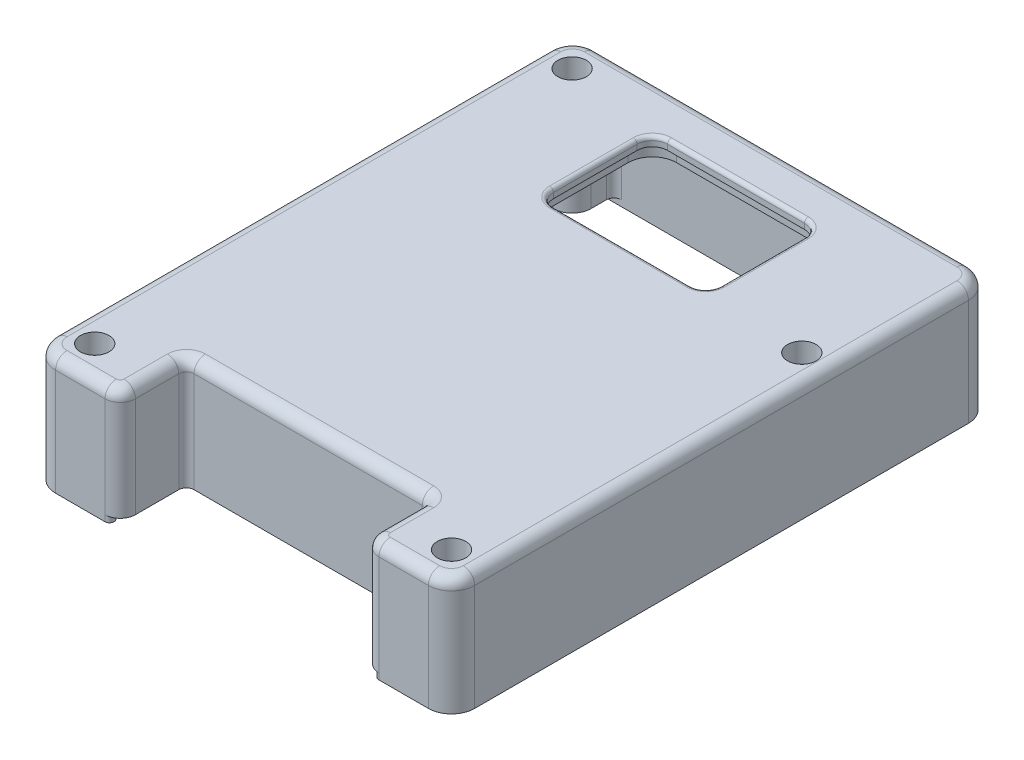
from build123d import *

# Parameters (mm, degrees)
ESQUISSE1_R             = 1.1
BOSS_EXTRU_1_DEPTH      = 13.5
BOSS_EXTRU_2_DEPTH      = 1.2
CONG_1_R                = 1.5
BOSS_EXTRU_3_START      = 0.8
BOSS_EXTRU_3_DEPTH      = 0.8
ESQUISSE4_W             = 37.676641801
ESQUISSE4_H             = 10.486455041
ENL_V_MAT_EXTRU_1_DEPTH = 0.8
CONG_2_R                = 0.6
ESQUISSE5_R             = 1.25
ENL_V_MAT_EXTRU_2_DEPTH = 48.156574303
ESQUISSE6_R             = 1.875
ENL_V_MAT_EXTRU_3_DEPTH = 3.3
CONG_3_R                = 0.6
CONG_4_R                = 0.7
ENL_V_MAT_EXTRU_4_DEPTH = 10
BOSS_EXTRU_4_DEPTH      = 2
CONG_5_R                = 0.5


with BuildPart() as part:
    # Esquisse1 → Boss.-Extru.1 (new body)
    with BuildSketch(Plane(origin=(0, 0, 0), x_dir=(1, 0, 0), z_dir=(0, 1, 0))):
        with BuildLine():
            Line((-24.5, 35.5), (24.5, 35.5))
            ThreePointArc((24.5, 35.5), (26.656675683, 34.606675683), (27.55, 32.45))
            Line((27.55, 32.45), (27.55, -32.45))
            ThreePointArc((27.55, -32.45), (26.656675683, -34.606675683), (24.5, -35.5))
            Line((24.5, -35.5), (18, -35.5))
            ThreePointArc((18, -35.5), (16.585786438, -34.914213562), (16, -33.5))
            Line((16, -33.5), (16, -27.8))
            ThreePointArc((16, -27.8), (15.707106781, -27.092893219), (15, -26.8))
            Line((15, -26.8), (0, -26.8))
            Line((0, -26.8), (-15, -26.8))
            ThreePointArc((-15, -26.8), (-15.707106781, -27.092893219), (-16, -27.8))
            Line((-16, -27.8), (-16, -33.5))
            ThreePointArc((-16, -33.5), (-16.585786438, -34.914213562), (-18, -35.5))
            Line((-18, -35.5), (-24.5, -35.5))
            ThreePointArc((-24.5, -35.5), (-26.656675683, -34.606675683), (-27.55, -32.45))
            Line((-27.55, -32.45), (-27.55, 32.45))
            ThreePointArc((-27.55, 32.45), (-26.656675683, 34.606675683), (-24.5, 35.5))
        make_face()
        with Locations(Location((-23.45, -31.4, 0), (0, 0, 270))):
            Circle(ESQUISSE1_R, mode=Mode.SUBTRACT)
        with Locations(Location((23.45, -31.4, 0), (0, 0, 270))):
            Circle(ESQUISSE1_R, mode=Mode.SUBTRACT)
        with Locations(Location((-23.4, 31.3, 0), (0, 0, 270))):
            Circle(ESQUISSE1_R, mode=Mode.SUBTRACT)
        with Locations(Location((24.05, 14.05, 0), (0, 0, 270))):
            Circle(ESQUISSE1_R, mode=Mode.SUBTRACT)
        with BuildLine():
            Line((-20.9, 31.3), (-20.9, 33.3))
            ThreePointArc((-20.9, 33.3), (-20.607106781, 34.007106781), (-19.9, 34.3))
            Line((-19.9, 34.3), (23.35, 34.3))
            ThreePointArc((23.35, 34.3), (25.471320344, 33.421320344), (26.35, 31.3))
            Line((26.35, 31.3), (26.35, 17.55))
            ThreePointArc((26.35, 17.55), (26.057106781, 16.842893219), (25.35, 16.55))
            Line((25.35, 16.55), (24.05, 16.55))
            ThreePointArc((24.05, 16.55), (21.55, 14.05), (24.05, 11.55))
            Line((24.05, 11.55), (25.35, 11.55))
            ThreePointArc((25.35, 11.55), (26.057106781, 11.257106781), (26.35, 10.55))
            Line((26.35, 10.55), (26.35, -27.9))
            ThreePointArc((26.35, -27.9), (26.057106781, -28.607106781), (25.35, -28.9))
            Line((25.35, -28.9), (23.45, -28.9))
            ThreePointArc((23.45, -28.9), (21.682233047, -29.632233047), (20.95, -31.4))
            Line((20.95, -31.4), (20.95, -33.3))
            ThreePointArc((20.95, -33.3), (20.657106781, -34.007106781), (19.95, -34.3))
            Line((19.95, -34.3), (18.2, -34.3))
            ThreePointArc((18.2, -34.3), (17.492893219, -34.007106781), (17.2, -33.3))
            Line((17.2, -33.3), (17.2, -26.6))
            ThreePointArc((17.2, -26.6), (16.907106781, -25.892893219), (16.2, -25.6))
            Line((16.2, -25.6), (-16.2, -25.6))
            ThreePointArc((-16.2, -25.6), (-16.907106781, -25.892893219), (-17.2, -26.6))
            Line((-17.2, -26.6), (-17.2, -33.3))
            ThreePointArc((-17.2, -33.3), (-17.492893219, -34.007106781), (-18.2, -34.3))
            Line((-18.2, -34.3), (-19.95, -34.3))
            ThreePointArc((-19.95, -34.3), (-20.657106781, -34.007106781), (-20.95, -33.3))
            Line((-20.95, -33.3), (-20.95, -31.4))
            ThreePointArc((-20.95, -31.4), (-21.682233047, -29.632233047), (-23.45, -28.9))
            Line((-23.45, -28.9), (-25.35, -28.9))
            ThreePointArc((-25.35, -28.9), (-26.057106781, -28.607106781), (-26.35, -27.9))
            Line((-26.35, -27.9), (-26.35, 27.8))
            ThreePointArc((-26.35, 27.8), (-26.057106781, 28.507106781), (-25.35, 28.8))
            Line((-25.35, 28.8), (-23.4, 28.8))
            ThreePointArc((-23.4, 28.8), (-21.632233047, 29.532233047), (-20.9, 31.3))
        make_face(mode=Mode.SUBTRACT)
    extrude(amount=BOSS_EXTRU_1_DEPTH)

    # Esquisse2 → Boss.-Extru.2 (add)
    with BuildSketch(Plane(origin=(0, 13.5, 0), x_dir=(1, 0, 0), z_dir=(0, 1, 0))):
        with BuildLine():
            Line((-24.5, -35.5), (-18, -35.5))
            ThreePointArc((-18, -35.5), (-16.585786438, -34.914213562), (-16, -33.5))
            Line((-16, -33.5), (-16, -27.8))
            ThreePointArc((-16, -27.8), (-15.707106781, -27.092893219), (-15, -26.8))
            Line((-15, -26.8), (15, -26.8))
            ThreePointArc((15, -26.8), (15.707106781, -27.092893219), (16, -27.8))
            Line((16, -27.8), (16, -33.5))
            ThreePointArc((16, -33.5), (16.585786438, -34.914213562), (18, -35.5))
            Line((18, -35.5), (24.5, -35.5))
            ThreePointArc((24.5, -35.5), (26.656675683, -34.606675683), (27.55, -32.45))
            Line((27.55, -32.45), (27.55, 32.45))
            ThreePointArc((27.55, 32.45), (26.656675683, 34.606675683), (24.5, 35.5))
            Line((24.5, 35.5), (-24.5, 35.5))
            ThreePointArc((-24.5, 35.5), (-26.656675683, 34.606675683), (-27.55, 32.45))
            Line((-27.55, 32.45), (-27.55, -32.45))
            ThreePointArc((-27.55, -32.45), (-26.656675683, -34.606675683), (-24.5, -35.5))
        make_face()
    extrude(amount=BOSS_EXTRU_2_DEPTH)

    # Congé1
    cong_1_edges = [part.edges().sort_by_distance(p)[0] for p in [
        (-26.656675683, 14.7, 34.606675683),
        (-21.25, 14.7, 35.5),
        (-16.585786438, 14.7, 34.914213562),
        (-16, 14.7, 30.65),
        (-15.707106781, 14.7, 27.092893219),
        (0, 14.7, 26.8),
        (15.707106781, 14.7, 27.092893219),
        (16, 14.7, 30.65),
        (16.585786438, 14.7, 34.914213562),
        (21.25, 14.7, 35.5),
        (26.656675683, 14.7, 34.606675683),
        (27.55, 14.7, 0),
        (26.656675683, 14.7, -34.606675683),
        (0, 14.7, -35.5),
        (-26.656675683, 14.7, -34.606675683),
        (-27.55, 14.7, 0),
    ]]
    fillet(cong_1_edges, radius=CONG_1_R)

    # Esquisse3 → Boss.-Extru.3 (add)
    with BuildSketch(Plane.XZ.offset(BOSS_EXTRU_3_START)):
        with BuildLine():
            Line((-27.55, 32.45), (-27.55, -32.45))
            ThreePointArc((-27.55, -32.45), (-26.656675683, -34.606675683), (-24.5, -35.5))
            Line((-24.5, -35.5), (24.5, -35.5))
            ThreePointArc((24.5, -35.5), (26.656675683, -34.606675683), (27.55, -32.45))
            Line((27.55, -32.45), (27.55, 32.45))
            ThreePointArc((27.55, 32.45), (26.656675683, 34.606675683), (24.5, 35.5))
            Line((24.5, 35.5), (18, 35.5))
            ThreePointArc((18, 35.5), (16.585786438, 34.914213562), (16, 33.5))
            Line((16, 33.5), (16, 27.8))
            ThreePointArc((16, 27.8), (15.707106781, 27.092893219), (15, 26.8))
            Line((15, 26.8), (-15, 26.8))
            ThreePointArc((-15, 26.8), (-15.707106781, 27.092893219), (-16, 27.8))
            Line((-16, 27.8), (-16, 33.5))
            ThreePointArc((-16, 33.5), (-16.585786438, 34.914213562), (-18, 35.5))
            Line((-18, 35.5), (-24.5, 35.5))
            ThreePointArc((-24.5, 35.5), (-26.656675683, 34.606675683), (-27.55, 32.45))
        make_face()
        with BuildLine():
            Line((-26.35, 32.45), (-26.35, -32.45))
            ThreePointArc((-26.35, -32.45), (-25.808147545, -33.758147545), (-24.5, -34.3))
            Line((-24.5, -34.3), (24.5, -34.3))
            ThreePointArc((24.5, -34.3), (25.808147545, -33.758147545), (26.35, -32.45))
            Line((26.35, -32.45), (26.35, 32.45))
            ThreePointArc((26.35, 32.45), (25.808147545, 33.758147545), (24.5, 34.3))
            Line((24.5, 34.3), (18, 34.3))
            ThreePointArc((18, 34.3), (17.434314575, 34.065685425), (17.2, 33.5))
            Line((17.2, 33.5), (17.2, 27.8))
            ThreePointArc((17.2, 27.8), (16.555634919, 26.244365081), (15, 25.6))
            Line((15, 25.6), (-15, 25.6))
            ThreePointArc((-15, 25.6), (-16.555634919, 26.244365081), (-17.2, 27.8))
            Line((-17.2, 27.8), (-17.2, 33.5))
            ThreePointArc((-17.2, 33.5), (-17.434314575, 34.065685425), (-18, 34.3))
            Line((-18, 34.3), (-24.5, 34.3))
            ThreePointArc((-24.5, 34.3), (-25.808147545, 33.758147545), (-26.35, 32.45))
        make_face(mode=Mode.SUBTRACT)
    extrude(amount=-BOSS_EXTRU_3_DEPTH)

    # Esquisse4 → Enlèv. mat.-Extru.1 (cut)
    with BuildSketch(Plane(origin=(0, -0.8, 0), x_dir=(-1, 0, 0), z_dir=(0, -1, 0))):
        with Locations((-0.005196081, -29.05677248)):
            Rectangle(ESQUISSE4_W, ESQUISSE4_H)
    extrude(amount=-ENL_V_MAT_EXTRU_1_DEPTH, mode=Mode.SUBTRACT)

    # Congé2
    # the kernel refuses this fillet: 0.6 mm, written as the material it takes off along each edge
    with BuildSketch(Plane(origin=(16.166969722, 0, 34.3), x_dir=(0.8366593072472588, 0, 0.5477236562323531), z_dir=(0, -1, 0))) as cong_2_piece_1:
        with BuildLine():
            CenterArc((1.86225296, -0.501996447), CONG_2_R, 56.789164482, 179.999849515)
            Line((1.533618766, -1.003992032), (0, 0))
            ThreePointArc((0, 0), (1.095442918, 0.326678508), (2.190885835, 0))
        make_face()
    extrude(amount=6.277214588, mode=Mode.SUBTRACT)
    with BuildSketch(Plane(origin=(-16.166969722, 0, 34.3), x_dir=(-0.8366593087517094, 0, 0.5477236539342736), z_dir=(0, -1, 0))) as cong_2_piece_2:
        with BuildLine():
            CenterArc((1.862252968, 0.501996447), CONG_2_R, 123.210985846, 179.99984983)
            Line((1.533618775, 1.003992032), (0, 0))
            ThreePointArc((0, 0), (1.095442922, -0.326678511), (2.190885844, 0))
        make_face()
    extrude(amount=6.277214611, mode=Mode.SUBTRACT)

    # Esquisse5 → Enlèv. mat.-Extru.2 (cut, through all)
    with BuildSketch(Plane.XZ.offset(-13.5)):
        with Locations(Location((-23.45, 31.4, 0), (0, 0, 270))):
            Circle(ESQUISSE5_R)
        with Locations(Location((23.45, 31.4, 0), (0, 0, 270))):
            Circle(ESQUISSE5_R)
        with Locations(Location((24.05, -14.05, 0), (0, 0, 270))):
            Circle(ESQUISSE5_R)
        with Locations(Location((-23.4, -31.3, 0), (0, 0, 270))):
            Circle(ESQUISSE5_R)
    extrude(amount=-ENL_V_MAT_EXTRU_2_DEPTH, mode=Mode.SUBTRACT)

    # Esquisse6 → Enlèv. mat.-Extru.3 (cut)
    with BuildSketch(Plane(origin=(0, 14.7, 0), x_dir=(1, 0, 0), z_dir=(0, 1, 0))):
        with Locations(Location((-23.4, 31.3, 0), (0, 0, 270))):
            Circle(ESQUISSE6_R)
        with Locations(Location((24.05, 14.05, 0), (0, 0, 270))):
            Circle(ESQUISSE6_R)
        with Locations(Location((23.45, -31.4, 0), (0, 0, 270))):
            Circle(ESQUISSE6_R)
        with Locations(Location((-23.45, -31.4, 0), (0, 0, 270))):
            Circle(ESQUISSE6_R)
    extrude(amount=-ENL_V_MAT_EXTRU_3_DEPTH, mode=Mode.SUBTRACT)

    # Congé3
    cong_3_edges = [part.edges().sort_by_distance(p)[0] for p in [
        (1.725, 13.5, -34.3),
        (-20.607106781, 13.5, -34.007106781),
        (-20.9, 13.5, -32.3),
        (-21.632233047, 13.5, -29.532233047),
        (-24.375, 13.5, -28.8),
        (-26.057106781, 13.5, -28.507106781),
        (-26.35, 13.5, 0.05),
        (-26.057106781, 13.5, 28.607106781),
        (-24.4, 13.5, 28.9),
        (-21.682233047, 13.5, 29.632233047),
        (-20.95, 13.5, 32.35),
        (-20.657106781, 13.5, 34.007106781),
        (-19.075, 13.5, 34.3),
        (-17.492893219, 13.5, 34.007106781),
        (-17.2, 13.5, 29.95),
        (-16.907106781, 13.5, 25.892893219),
        (0, 13.5, 25.6),
        (16.907106781, 13.5, 25.892893219),
        (17.2, 13.5, 29.95),
        (17.492893219, 13.5, 34.007106781),
        (19.075, 13.5, 34.3),
        (20.657106781, 13.5, 34.007106781),
        (20.95, 13.5, 32.35),
        (21.682233047, 13.5, 29.632233047),
        (24.4, 13.5, 28.9),
        (26.057106781, 13.5, 28.607106781),
        (26.35, 13.5, 8.675),
        (26.057106781, 13.5, -11.257106781),
        (24.7, 13.5, -11.55),
        (21.55, 13.5, -14.05),
        (24.7, 13.5, -16.55),
        (26.057106781, 13.5, -16.842893219),
        (26.35, 13.5, -24.425),
        (25.471320344, 13.5, -33.421320344),
    ]]
    fillet(cong_3_edges, radius=CONG_3_R)

    # Congé4
    cong_4_edges = [part.edges().sort_by_distance(p)[0] for p in [
        (-23.4, 11.4, -33.175),
        (24.05, 11.4, -15.925),
        (23.45, 11.4, 29.525),
        (-23.45, 11.4, 29.525),
    ]]
    fillet(cong_4_edges, radius=CONG_4_R)

    # Esquisse7 → Enlèv. mat.-Extru.4 (cut)
    with BuildSketch(Plane.XZ.offset(-13.5)):
        with BuildLine():
            Line((-9, -14.45), (9, -14.45))
            ThreePointArc((9, -14.45), (10.414213562, -15.035786438), (11, -16.45))
            Line((11, -16.45), (11, -27.45))
            ThreePointArc((11, -27.45), (10.414213562, -28.864213562), (9, -29.45))
            Line((9, -29.45), (-9, -29.45))
            ThreePointArc((-9, -29.45), (-10.414213562, -28.864213562), (-11, -27.45))
            Line((-11, -27.45), (-11, -16.45))
            ThreePointArc((-11, -16.45), (-10.414213562, -15.035786438), (-9, -14.45))
        make_face()
    extrude(amount=-ENL_V_MAT_EXTRU_4_DEPTH, mode=Mode.SUBTRACT)

    # Esquisse8 → Boss.-Extru.4 (add)
    with BuildSketch(Plane.XZ.offset(-13.5)):
        with BuildLine():
            Line((-13.4, -16.45), (-13.4, -27.45))
            ThreePointArc((-13.4, -27.45), (-12.111269837, -30.561269837), (-9, -31.85))
            Line((-9, -31.85), (9, -31.85))
            ThreePointArc((9, -31.85), (12.111269837, -30.561269837), (13.4, -27.45))
            Line((13.4, -27.45), (13.4, -16.45))
            ThreePointArc((13.4, -16.45), (12.111269837, -13.338730163), (9, -12.05))
            Line((9, -12.05), (-9, -12.05))
            ThreePointArc((-9, -12.05), (-12.111269837, -13.338730163), (-13.4, -16.45))
        make_face()
        with BuildLine():
            Line((-9, -30.65), (9, -30.65))
            ThreePointArc((9, -30.65), (11.2627417, -29.7127417), (12.2, -27.45))
            Line((12.2, -27.45), (12.2, -16.45))
            ThreePointArc((12.2, -16.45), (11.2627417, -14.1872583), (9, -13.25))
            Line((9, -13.25), (-9, -13.25))
            ThreePointArc((-9, -13.25), (-11.2627417, -14.1872583), (-12.2, -16.45))
            Line((-12.2, -16.45), (-12.2, -27.45))
            ThreePointArc((-12.2, -27.45), (-11.2627417, -29.7127417), (-9, -30.65))
        make_face(mode=Mode.SUBTRACT)
    extrude(amount=BOSS_EXTRU_4_DEPTH)

    # Congé5
    cong_5_edges = [part.edges().sort_by_distance(p)[0] for p in [
        (0, 14.7, -14.45),
        (-10.414213562, 14.7, -15.035786438),
        (-11, 14.7, -21.95),
        (-10.414213562, 14.7, -28.864213562),
        (0, 14.7, -29.45),
        (10.414213562, 14.7, -28.864213562),
        (11, 14.7, -21.95),
        (10.414213562, 14.7, -15.035786438),
    ]]
    fillet(cong_5_edges, radius=CONG_5_R)


solid = part.part
